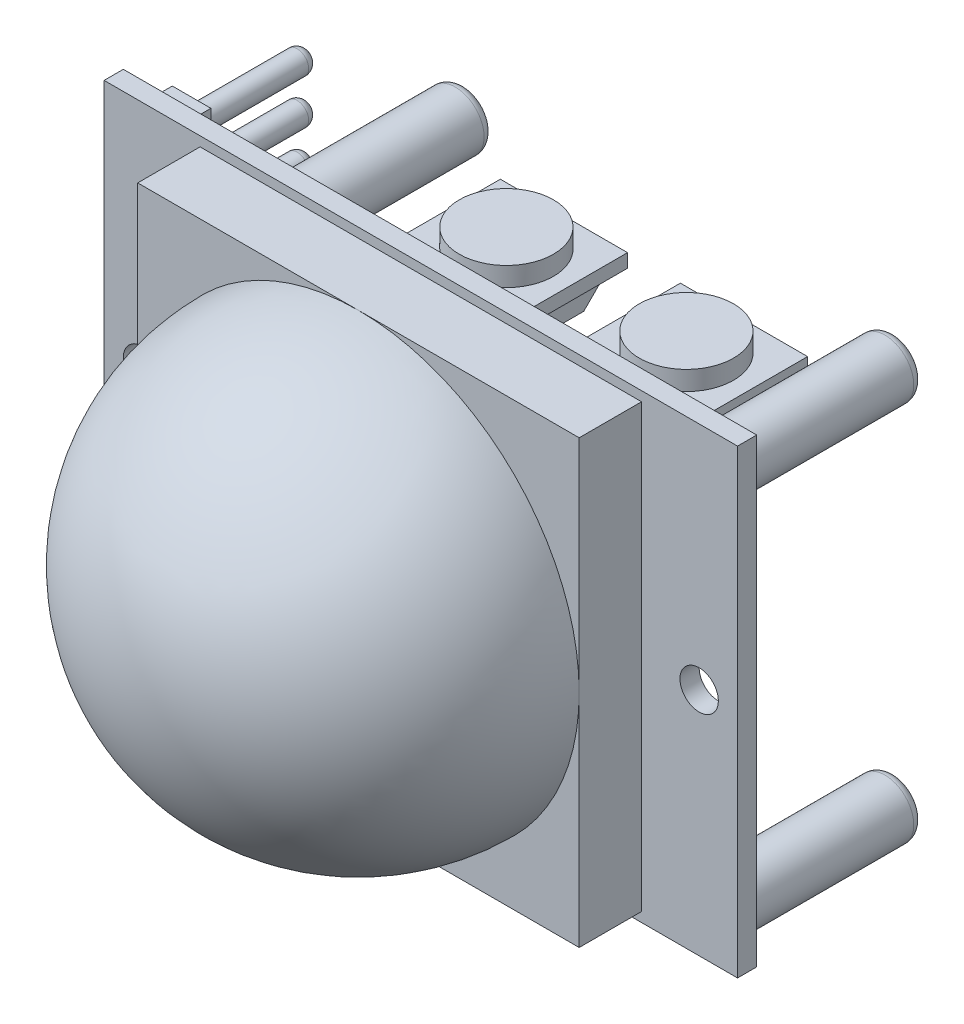
from build123d import *

# Parameters (mm, degrees)
SKETCH1_W           = 33
SKETCH1_H           = 24
BOSS_EXTRUDE1_DEPTH = 1
SKETCH2_W           = 23
SKETCH2_H           = 23
BOSS_EXTRUDE2_DEPTH = 3.25
SKETCH3_R           = 11.5
BOSS_EXTRUDE3_DEPTH = 11.5
FILLET1_R           = 11.5
SKETCH4_R           = 1
CUT_EXTRUDE1_DEPTH  = 11.5
SKETCH5_R           = 1.5
BOSS_EXTRUDE4_DEPTH = 9
SKETCH6_W           = 2.010687131
SKETCH6_H           = 6.995515646
SKETCH6_W_2         = 7
SKETCH6_H_2         = 2
SKETCH6_W_3         = 2
SKETCH6_H_3         = 0.586450414
BOSS_EXTRUDE5_DEPTH = 1.5
SKETCH9_R           = 0.6
SKETCH9_W           = 6.627463767
SKETCH9_H           = 0.70355822
BOSS_EXTRUDE6_DEPTH = 6
FILLET2_R           = 0.5
SKETCH10_W          = 5.856593569
SKETCH10_H          = 4.722427078
SKETCH10_W_2        = 5.818133948
BOSS_EXTRUDE7_DEPTH = 1.5
CHAMFER1_SIZE       = 1
SKETCH11_R          = 2.455204391
BOSS_EXTRUDE8_DEPTH = 1
SKETCH12_W          = 2.5
SKETCH12_H          = 1
SKETCH12_W_2        = 1
SKETCH12_H_2        = 2.5
SKETCH12_W_3        = 4.859560483
SKETCH12_H_3        = 9.150448994
SKETCH12_W_4        = 4.084098704
SKETCH12_H_4        = 2
BOSS_EXTRUDE9_DEPTH = 0.5


with BuildPart() as part:
    # Sketch1 → Boss-Extrude1 (new body)
    with BuildSketch(Plane.XY):
        Rectangle(SKETCH1_W, SKETCH1_H)
    extrude(amount=BOSS_EXTRUDE1_DEPTH)

    # Sketch2 → Boss-Extrude2 (add)
    with BuildSketch(Plane.XY.offset(1)):
        Rectangle(SKETCH2_W, SKETCH2_H)
    extrude(amount=BOSS_EXTRUDE2_DEPTH)

    # Sketch3 → Boss-Extrude3 (add)
    with BuildSketch(Plane.XY.offset(4.25)):
        Circle(SKETCH3_R)
    extrude(amount=BOSS_EXTRUDE3_DEPTH)

    # Fillet1
    fillet1_edges = [part.edges().sort_by_distance(p)[0] for p in [
        (-11.5, 0, 15.75),
    ]]
    fillet(fillet1_edges, radius=FILLET1_R - 0.0001)  # a hair under: the kernel refuses the full size

    # Sketch4 → Cut-Extrude1 (cut)
    with BuildSketch(Plane.XY.offset(1)):
        with Locations((14.5, 0)):
            Circle(SKETCH4_R)
        with Locations(Location((-14.5, 0, 0), (0, 0, 180))):
            Circle(SKETCH4_R)
    extrude(amount=-CUT_EXTRUDE1_DEPTH, mode=Mode.SUBTRACT)

    # Sketch5 → Boss-Extrude4 (add)
    with BuildSketch(Plane(origin=(0, 0, 0), x_dir=(-1, 0, 0), z_dir=(0, 0, -1))):
        with Locations((-14.682076353, 9.848364596)):
            Circle(SKETCH5_R)
        with Locations((-14.682076353, -10.003456952)):
            Circle(SKETCH5_R)
        with Locations((14.06170693, -10.003456952)):
            Circle(SKETCH5_R)
        with Locations((7.70292034, 9.848364596)):
            Circle(SKETCH5_R)
    extrude(amount=BOSS_EXTRUDE4_DEPTH)

    # Sketch6 → Boss-Extrude5 (add)
    with BuildSketch(Plane(origin=(0, 0, 0), x_dir=(-1, 0, 0), z_dir=(0, 0, -1))):
        with Locations((14.443495408, 7.52381805)):
            Rectangle(SKETCH6_W, SKETCH6_H)
        with Locations((0, -9)):
            Rectangle(SKETCH6_W_2, SKETCH6_H_2)
        with Locations((-8.023414107, 9.304113948)):
            Rectangle(SKETCH6_W_3, SKETCH6_H_3)
        with Locations((1.044258094, 9.304113948)):
            Rectangle(SKETCH6_W_3, SKETCH6_H_3)
    extrude(amount=BOSS_EXTRUDE5_DEPTH)

    # Sketch9 → Boss-Extrude6 (add)
    with BuildSketch(Plane(origin=(0, 0, -1.5), x_dir=(-1, 0, 0), z_dir=(0, 0, -1))):
        with Locations((0, -9)):
            Circle(SKETCH9_R)
        with Locations((-2.35, -9)):
            Circle(SKETCH9_R)
        with Locations(Location((2.35, -9, 0), (0, 0, 180))):
            Circle(SKETCH9_R)
        with Locations(Location((14.443495407, 7.52381805, 0), (0, 0, 180))):
            Circle(SKETCH9_R)
        with Locations(Location((14.443495407, 9.856575873, 0), (0, 0, 180))):
            Circle(SKETCH9_R)
        with Locations(Location((14.443495407, 5.191060227, 0), (0, 0, 180))):
            Circle(SKETCH9_R)
        with Locations((1.044258094, 9.010888741)):
            Rectangle(SKETCH9_W, SKETCH9_H)
        with Locations((-8.33582718, 9.010888741)):
            Rectangle(SKETCH9_W, SKETCH9_H)
    extrude(amount=BOSS_EXTRUDE6_DEPTH)

    # Fillet2
    fillet2_edges = [part.edges().sort_by_distance(p)[0] for p in [
        (0.6, -9, -7.5),
        (2.95, -9, -7.5),
        (-2.95, -9, -7.5),
        (-15.043495407, 7.52381805, -7.5),
        (-15.043495407, 9.856575873, -7.5),
        (-15.043495407, 5.191060227, -7.5),
        (16.182076353, 9.848364596, -9),
        (16.182076353, -10.003456952, -9),
        (-12.56170693, -10.003456952, -9),
        (-6.20292034, 9.848364596, -9),
    ]]
    fillet(fillet2_edges, radius=FILLET2_R)

    # Sketch10 → Boss-Extrude7 (add)
    with BuildSketch(Plane.XZ.offset(-8.659109631)):
        with Locations((8.339737399, -4.551230494)):
            Rectangle(SKETCH10_W, SKETCH10_H)
        with Locations((-1.334508632, -4.551230494)):
            Rectangle(SKETCH10_W_2, SKETCH10_H)
    extrude(amount=BOSS_EXTRUDE7_DEPTH)

    # Chamfer1
    chamfer1_edges = [part.edges().sort_by_distance(p)[0] for p in [
        (8.339737398, 7.159109631, -2.190016955),
        (8.339737398, 7.159109631, -6.912444033),
        (-1.334508632, 7.159109631, -2.190016955),
        (-1.334508632, 7.159109631, -6.912444033),
    ]]
    chamfer(chamfer1_edges, length=CHAMFER1_SIZE)

    # Sketch11 → Boss-Extrude8 (add)
    with BuildSketch(Plane(origin=(0, 9.362667851, 0), x_dir=(1, 0, 0), z_dir=(0, 1, 0))):
        with Locations(Location((-1.044258094, 4.5, 0), (0, 0, 90))):
            Circle(SKETCH11_R)
        with Locations(Location((8.33582718, 4.5, 0), (0, 0, 90))):
            Circle(SKETCH11_R)
    extrude(amount=BOSS_EXTRUDE8_DEPTH)

    # Sketch12 → Boss-Extrude9 (add)
    with BuildSketch(Plane(origin=(0, 0, 0), x_dir=(-1, 0, 0), z_dir=(0, 0, -1))):
        with Locations((-10.759235584, 4.299762718)):
            Rectangle(SKETCH12_W, SKETCH12_H)
        with Locations((-14.259235584, 4.299762718)):
            Rectangle(SKETCH12_W, SKETCH12_H)
        with Locations((-7.259235584, 4.299762718)):
            Rectangle(SKETCH12_W, SKETCH12_H)
        with Locations((-3.759235584, 4.299762718)):
            Rectangle(SKETCH12_W, SKETCH12_H)
        with Locations((-0.259235584, 4.299762718)):
            Rectangle(SKETCH12_W, SKETCH12_H)
        with Locations((6.740764416, 5.799762718)):
            Rectangle(SKETCH12_W, SKETCH12_H)
        with Locations((6.740764416, 4.299762718)):
            Rectangle(SKETCH12_W, SKETCH12_H)
        with Locations((10.240764416, 4.299762718)):
            Rectangle(SKETCH12_W, SKETCH12_H)
        with Locations((10.240764416, 5.799762718)):
            Rectangle(SKETCH12_W, SKETCH12_H)
        with Locations((-6.582550917, -3.551310505)):
            Rectangle(SKETCH12_W_2, SKETCH12_H_2)
        with Locations((8.323289764, -2.11959553)):
            Rectangle(SKETCH12_W_3, SKETCH12_H_3)
        with Locations((-6.582550917, 0.448689495)):
            Rectangle(SKETCH12_W_2, SKETCH12_H_2)
        with Locations((-8.082550917, -3.551310505)):
            Rectangle(SKETCH12_W_2, SKETCH12_H_2)
        with Locations((-12.019657578, -5.200237282)):
            Rectangle(SKETCH12_W_4, SKETCH12_H_4)
        with Locations((-3.759235584, -1.700237282)):
            Rectangle(SKETCH12_W, SKETCH12_H)
        with Locations((-3.759235584, -3.700237282)):
            Rectangle(SKETCH12_W, SKETCH12_H)
        with Locations((-0.259235584, -3.700237282)):
            Rectangle(SKETCH12_W, SKETCH12_H)
        with Locations((-0.259235584, -5.700237282)):
            Rectangle(SKETCH12_W, SKETCH12_H)
    extrude(amount=BOSS_EXTRUDE9_DEPTH)


solid = part.part
